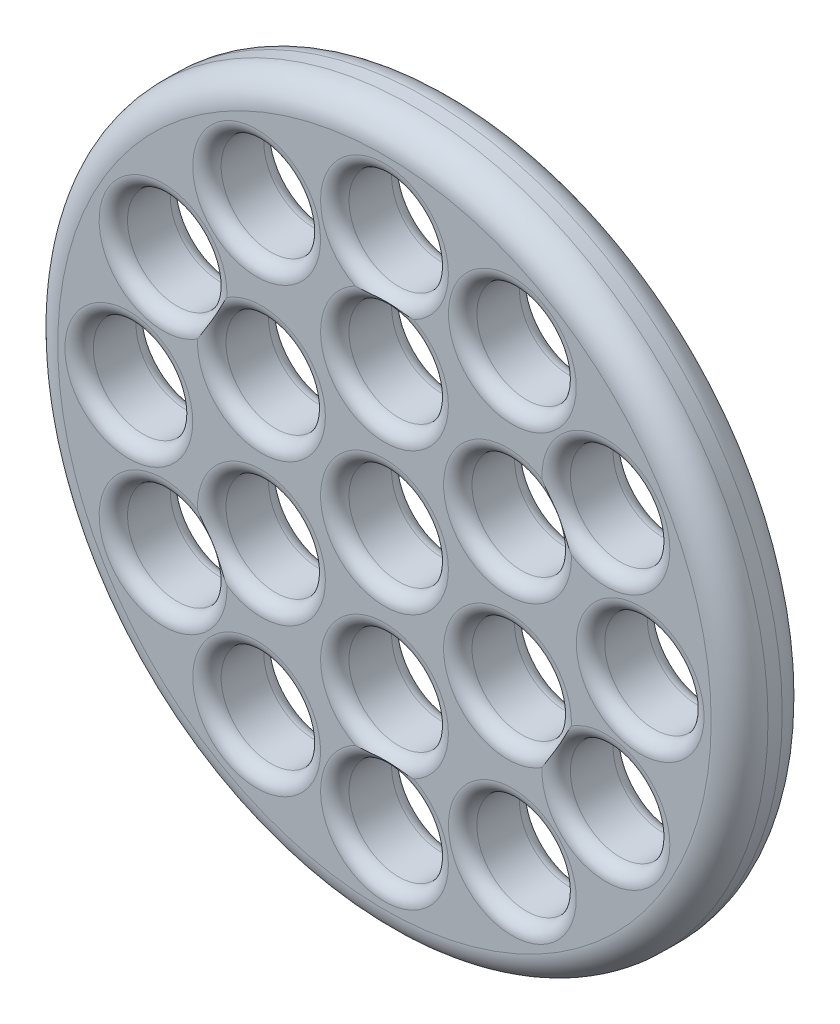
from build123d import *

# Parameters (mm, degrees)
SKETCH1_R           = 25
SKETCH1_R_2         = 22.5
SKETCH1_R_3         = 3.5
BOSS_EXTRUDE5_DEPTH = 5
FILLET10_R          = 2
FILLET11_R          = 1


with BuildPart() as part:
    # Sketch1 → Boss-Extrude5 (new body)
    # profile 1 of 2: a face of its own
    with BuildSketch(Plane.XY):
        Circle(SKETCH1_R)
        Circle(SKETCH1_R_2, mode=Mode.SUBTRACT)
    # profile 2 of 2: a face of its own
    with BuildSketch(Plane.XY):
        Circle(SKETCH1_R_2)
        with Locations((-15.588457268, -9)):
            Circle(SKETCH1_R_3, mode=Mode.SUBTRACT)
        with Locations((-9, -15.588457268)):
            Circle(SKETCH1_R_3, mode=Mode.SUBTRACT)
        with Locations((0, -18)):
            Circle(SKETCH1_R_3, mode=Mode.SUBTRACT)
        with Locations((9, -15.588457268)):
            Circle(SKETCH1_R_3, mode=Mode.SUBTRACT)
        with Locations((15.588457268, -9)):
            Circle(SKETCH1_R_3, mode=Mode.SUBTRACT)
        with Locations((18, 0)):
            Circle(SKETCH1_R_3, mode=Mode.SUBTRACT)
        with Locations((15.588457268, 9)):
            Circle(SKETCH1_R_3, mode=Mode.SUBTRACT)
        with Locations((9, 15.588457268)):
            Circle(SKETCH1_R_3, mode=Mode.SUBTRACT)
        with Locations((0, 18)):
            Circle(SKETCH1_R_3, mode=Mode.SUBTRACT)
        with Locations((-9, 15.588457268)):
            Circle(SKETCH1_R_3, mode=Mode.SUBTRACT)
        with Locations((-15.588457268, 9)):
            Circle(SKETCH1_R_3, mode=Mode.SUBTRACT)
        with Locations((-18, 0)):
            Circle(SKETCH1_R_3, mode=Mode.SUBTRACT)
        with Locations((-8.660254038, 5)):
            Circle(SKETCH1_R_3, mode=Mode.SUBTRACT)
        with Locations((-8.660254038, -5)):
            Circle(SKETCH1_R_3, mode=Mode.SUBTRACT)
        with Locations((0, -10)):
            Circle(SKETCH1_R_3, mode=Mode.SUBTRACT)
        with Locations((8.660254038, -5)):
            Circle(SKETCH1_R_3, mode=Mode.SUBTRACT)
        with Locations((8.660254038, 5)):
            Circle(SKETCH1_R_3, mode=Mode.SUBTRACT)
        Circle(SKETCH1_R_3, mode=Mode.SUBTRACT)
        with Locations((0, 10)):
            Circle(SKETCH1_R_3, mode=Mode.SUBTRACT)
    extrude(amount=BOSS_EXTRUDE5_DEPTH)

    # Fillet10
    fillet10_edges = [part.edges().sort_by_distance(p)[0] for p in [
        (-25, 0, 0),
        (-25, 0, 5),
    ]]
    fillet(fillet10_edges, radius=FILLET10_R)

    # Fillet11
    # the kernel refuses this fillet: 1 mm, written as the material it takes off along each edge
    with BuildSketch(Plane(origin=(-15.588457268, -9, 5), x_dir=(1, 0, 0), z_dir=(0, -1, 0))) as fillet11_piece_1:
        with BuildLine():
            CenterArc((3.5 + FILLET11_R, -FILLET11_R), FILLET11_R, 90, 90)
            Line((3.5, -FILLET11_R), (3.5, 0))
            Line((3.5, 0), (3.5 + FILLET11_R, 0))
        make_face()
    revolve(axis=Axis((-15.588457268, -9, 5), (0, 0, 1)), mode=Mode.SUBTRACT)
    with BuildSketch(Plane(origin=(0, 10, 0), x_dir=(1, 0, 0), z_dir=(0, -1, 0))) as fillet11_piece_2:
        with BuildLine():
            CenterArc((3.5 + FILLET11_R, FILLET11_R), FILLET11_R, 180, 90)
            Line((3.5, FILLET11_R), (3.5, 0))
            Line((3.5, 0), (3.5 + FILLET11_R, 0))
        make_face()
    revolve(axis=Axis((0, 10, 0), (0, 0, 1)), mode=Mode.SUBTRACT)
    with BuildSketch(Plane(origin=(0, 0, 0), x_dir=(1, 0, 0), z_dir=(0, -1, 0))) as fillet11_piece_3:
        with BuildLine():
            CenterArc((3.5 + FILLET11_R, FILLET11_R), FILLET11_R, 180, 90)
            Line((3.5, FILLET11_R), (3.5, 0))
            Line((3.5, 0), (3.5 + FILLET11_R, 0))
        make_face()
    revolve(axis=Axis((0, 0, 0), (0, 0, 1)), mode=Mode.SUBTRACT)
    with BuildSketch(Plane(origin=(8.660254038, 5, 0), x_dir=(1, 0, 0), z_dir=(0, -1, 0))) as fillet11_piece_4:
        with BuildLine():
            CenterArc((3.5 + FILLET11_R, FILLET11_R), FILLET11_R, 180, 90)
            Line((3.5, FILLET11_R), (3.5, 0))
            Line((3.5, 0), (3.5 + FILLET11_R, 0))
        make_face()
    revolve(axis=Axis((8.660254038, 5, 0), (0, 0, 1)), mode=Mode.SUBTRACT)
    with BuildSketch(Plane(origin=(8.660254038, -5, 0), x_dir=(1, 0, 0), z_dir=(0, -1, 0))) as fillet11_piece_5:
        with BuildLine():
            CenterArc((3.5 + FILLET11_R, FILLET11_R), FILLET11_R, 180, 90)
            Line((3.5, FILLET11_R), (3.5, 0))
            Line((3.5, 0), (3.5 + FILLET11_R, 0))
        make_face()
    revolve(axis=Axis((8.660254038, -5, 0), (0, 0, 1)), mode=Mode.SUBTRACT)
    with BuildSketch(Plane(origin=(0, -10, 0), x_dir=(1, 0, 0), z_dir=(0, -1, 0))) as fillet11_piece_6:
        with BuildLine():
            CenterArc((3.5 + FILLET11_R, FILLET11_R), FILLET11_R, 180, 90)
            Line((3.5, FILLET11_R), (3.5, 0))
            Line((3.5, 0), (3.5 + FILLET11_R, 0))
        make_face()
    revolve(axis=Axis((0, -10, 0), (0, 0, 1)), mode=Mode.SUBTRACT)
    with BuildSketch(Plane(origin=(-8.660254038, -5, 0), x_dir=(1, 0, 0), z_dir=(0, -1, 0))) as fillet11_piece_7:
        with BuildLine():
            CenterArc((3.5 + FILLET11_R, FILLET11_R), FILLET11_R, 180, 90)
            Line((3.5, FILLET11_R), (3.5, 0))
            Line((3.5, 0), (3.5 + FILLET11_R, 0))
        make_face()
    revolve(axis=Axis((-8.660254038, -5, 0), (0, 0, 1)), mode=Mode.SUBTRACT)
    with BuildSketch(Plane(origin=(-8.660254038, 5, 0), x_dir=(1, 0, 0), z_dir=(0, -1, 0))) as fillet11_piece_8:
        with BuildLine():
            CenterArc((3.5 + FILLET11_R, FILLET11_R), FILLET11_R, 180, 90)
            Line((3.5, FILLET11_R), (3.5, 0))
            Line((3.5, 0), (3.5 + FILLET11_R, 0))
        make_face()
    revolve(axis=Axis((-8.660254038, 5, 0), (0, 0, 1)), mode=Mode.SUBTRACT)
    with BuildSketch(Plane(origin=(-18, 0, 0), x_dir=(1, 0, 0), z_dir=(0, -1, 0))) as fillet11_piece_9:
        with BuildLine():
            CenterArc((3.5 + FILLET11_R, FILLET11_R), FILLET11_R, 180, 90)
            Line((3.5, FILLET11_R), (3.5, 0))
            Line((3.5, 0), (3.5 + FILLET11_R, 0))
        make_face()
    revolve(axis=Axis((-18, 0, 0), (0, 0, 1)), mode=Mode.SUBTRACT)
    with BuildSketch(Plane(origin=(-9, -15.588457268, 5), x_dir=(1, 0, 0), z_dir=(0, -1, 0))) as fillet11_piece_10:
        with BuildLine():
            CenterArc((3.5 + FILLET11_R, -FILLET11_R), FILLET11_R, 90, 90)
            Line((3.5, -FILLET11_R), (3.5, 0))
            Line((3.5, 0), (3.5 + FILLET11_R, 0))
        make_face()
    revolve(axis=Axis((-9, -15.588457268, 5), (0, 0, 1)), mode=Mode.SUBTRACT)
    with BuildSketch(Plane(origin=(-15.588457268, 9, 0), x_dir=(1, 0, 0), z_dir=(0, -1, 0))) as fillet11_piece_11:
        with BuildLine():
            CenterArc((3.5 + FILLET11_R, FILLET11_R), FILLET11_R, 180, 90)
            Line((3.5, FILLET11_R), (3.5, 0))
            Line((3.5, 0), (3.5 + FILLET11_R, 0))
        make_face()
    revolve(axis=Axis((-15.588457268, 9, 0), (0, 0, 1)), mode=Mode.SUBTRACT)
    with BuildSketch(Plane(origin=(-9, 15.588457268, 0), x_dir=(1, 0, 0), z_dir=(0, -1, 0))) as fillet11_piece_12:
        with BuildLine():
            CenterArc((3.5 + FILLET11_R, FILLET11_R), FILLET11_R, 180, 90)
            Line((3.5, FILLET11_R), (3.5, 0))
            Line((3.5, 0), (3.5 + FILLET11_R, 0))
        make_face()
    revolve(axis=Axis((-9, 15.588457268, 0), (0, 0, 1)), mode=Mode.SUBTRACT)
    with BuildSketch(Plane(origin=(0, 18, 0), x_dir=(1, 0, 0), z_dir=(0, -1, 0))) as fillet11_piece_13:
        with BuildLine():
            CenterArc((3.5 + FILLET11_R, FILLET11_R), FILLET11_R, 180, 90)
            Line((3.5, FILLET11_R), (3.5, 0))
            Line((3.5, 0), (3.5 + FILLET11_R, 0))
        make_face()
    revolve(axis=Axis((0, 18, 0), (0, 0, 1)), mode=Mode.SUBTRACT)
    with BuildSketch(Plane(origin=(9, 15.588457268, 0), x_dir=(1, 0, 0), z_dir=(0, -1, 0))) as fillet11_piece_14:
        with BuildLine():
            CenterArc((3.5 + FILLET11_R, FILLET11_R), FILLET11_R, 180, 90)
            Line((3.5, FILLET11_R), (3.5, 0))
            Line((3.5, 0), (3.5 + FILLET11_R, 0))
        make_face()
    revolve(axis=Axis((9, 15.588457268, 0), (0, 0, 1)), mode=Mode.SUBTRACT)
    with BuildSketch(Plane(origin=(15.588457268, 9, 0), x_dir=(1, 0, 0), z_dir=(0, -1, 0))) as fillet11_piece_15:
        with BuildLine():
            CenterArc((3.5 + FILLET11_R, FILLET11_R), FILLET11_R, 180, 90)
            Line((3.5, FILLET11_R), (3.5, 0))
            Line((3.5, 0), (3.5 + FILLET11_R, 0))
        make_face()
    revolve(axis=Axis((15.588457268, 9, 0), (0, 0, 1)), mode=Mode.SUBTRACT)
    with BuildSketch(Plane(origin=(18, 0, 0), x_dir=(1, 0, 0), z_dir=(0, -1, 0))) as fillet11_piece_16:
        with BuildLine():
            CenterArc((3.5 + FILLET11_R, FILLET11_R), FILLET11_R, 180, 90)
            Line((3.5, FILLET11_R), (3.5, 0))
            Line((3.5, 0), (3.5 + FILLET11_R, 0))
        make_face()
    revolve(axis=Axis((18, 0, 0), (0, 0, 1)), mode=Mode.SUBTRACT)
    with BuildSketch(Plane(origin=(15.588457268, -9, 0), x_dir=(1, 0, 0), z_dir=(0, -1, 0))) as fillet11_piece_17:
        with BuildLine():
            CenterArc((3.5 + FILLET11_R, FILLET11_R), FILLET11_R, 180, 90)
            Line((3.5, FILLET11_R), (3.5, 0))
            Line((3.5, 0), (3.5 + FILLET11_R, 0))
        make_face()
    revolve(axis=Axis((15.588457268, -9, 0), (0, 0, 1)), mode=Mode.SUBTRACT)
    with BuildSketch(Plane(origin=(9, -15.588457268, 0), x_dir=(1, 0, 0), z_dir=(0, -1, 0))) as fillet11_piece_18:
        with BuildLine():
            CenterArc((3.5 + FILLET11_R, FILLET11_R), FILLET11_R, 180, 90)
            Line((3.5, FILLET11_R), (3.5, 0))
            Line((3.5, 0), (3.5 + FILLET11_R, 0))
        make_face()
    revolve(axis=Axis((9, -15.588457268, 0), (0, 0, 1)), mode=Mode.SUBTRACT)
    with BuildSketch(Plane(origin=(0, -18, 5), x_dir=(1, 0, 0), z_dir=(0, -1, 0))) as fillet11_piece_19:
        with BuildLine():
            CenterArc((3.5 + FILLET11_R, -FILLET11_R), FILLET11_R, 90, 90)
            Line((3.5, -FILLET11_R), (3.5, 0))
            Line((3.5, 0), (3.5 + FILLET11_R, 0))
        make_face()
    revolve(axis=Axis((0, -18, 5), (0, 0, 1)), mode=Mode.SUBTRACT)
    with BuildSketch(Plane(origin=(0, -18, 0), x_dir=(1, 0, 0), z_dir=(0, -1, 0))) as fillet11_piece_20:
        with BuildLine():
            CenterArc((3.5 + FILLET11_R, FILLET11_R), FILLET11_R, 180, 90)
            Line((3.5, FILLET11_R), (3.5, 0))
            Line((3.5, 0), (3.5 + FILLET11_R, 0))
        make_face()
    revolve(axis=Axis((0, -18, 0), (0, 0, 1)), mode=Mode.SUBTRACT)
    with BuildSketch(Plane(origin=(-9, -15.588457268, 0), x_dir=(1, 0, 0), z_dir=(0, -1, 0))) as fillet11_piece_21:
        with BuildLine():
            CenterArc((3.5 + FILLET11_R, FILLET11_R), FILLET11_R, 180, 90)
            Line((3.5, FILLET11_R), (3.5, 0))
            Line((3.5, 0), (3.5 + FILLET11_R, 0))
        make_face()
    revolve(axis=Axis((-9, -15.588457268, 0), (0, 0, 1)), mode=Mode.SUBTRACT)
    with BuildSketch(Plane(origin=(-15.588457268, -9, 0), x_dir=(1, 0, 0), z_dir=(0, -1, 0))) as fillet11_piece_22:
        with BuildLine():
            CenterArc((3.5 + FILLET11_R, FILLET11_R), FILLET11_R, 180, 90)
            Line((3.5, FILLET11_R), (3.5, 0))
            Line((3.5, 0), (3.5 + FILLET11_R, 0))
        make_face()
    revolve(axis=Axis((-15.588457268, -9, 0), (0, 0, 1)), mode=Mode.SUBTRACT)
    with BuildSketch(Plane(origin=(9, -15.588457268, 5), x_dir=(1, 0, 0), z_dir=(0, -1, 0))) as fillet11_piece_23:
        with BuildLine():
            CenterArc((3.5 + FILLET11_R, -FILLET11_R), FILLET11_R, 90, 90)
            Line((3.5, -FILLET11_R), (3.5, 0))
            Line((3.5, 0), (3.5 + FILLET11_R, 0))
        make_face()
    revolve(axis=Axis((9, -15.588457268, 5), (0, 0, 1)), mode=Mode.SUBTRACT)
    with BuildSketch(Plane(origin=(15.588457268, -9, 5), x_dir=(1, 0, 0), z_dir=(0, -1, 0))) as fillet11_piece_24:
        with BuildLine():
            CenterArc((3.5 + FILLET11_R, -FILLET11_R), FILLET11_R, 90, 90)
            Line((3.5, -FILLET11_R), (3.5, 0))
            Line((3.5, 0), (3.5 + FILLET11_R, 0))
        make_face()
    revolve(axis=Axis((15.588457268, -9, 5), (0, 0, 1)), mode=Mode.SUBTRACT)
    with BuildSketch(Plane(origin=(18, 0, 5), x_dir=(1, 0, 0), z_dir=(0, -1, 0))) as fillet11_piece_25:
        with BuildLine():
            CenterArc((3.5 + FILLET11_R, -FILLET11_R), FILLET11_R, 90, 90)
            Line((3.5, -FILLET11_R), (3.5, 0))
            Line((3.5, 0), (3.5 + FILLET11_R, 0))
        make_face()
    revolve(axis=Axis((18, 0, 5), (0, 0, 1)), mode=Mode.SUBTRACT)
    with BuildSketch(Plane(origin=(15.588457268, 9, 5), x_dir=(1, 0, 0), z_dir=(0, -1, 0))) as fillet11_piece_26:
        with BuildLine():
            CenterArc((3.5 + FILLET11_R, -FILLET11_R), FILLET11_R, 90, 90)
            Line((3.5, -FILLET11_R), (3.5, 0))
            Line((3.5, 0), (3.5 + FILLET11_R, 0))
        make_face()
    revolve(axis=Axis((15.588457268, 9, 5), (0, 0, 1)), mode=Mode.SUBTRACT)
    with BuildSketch(Plane(origin=(9, 15.588457268, 5), x_dir=(1, 0, 0), z_dir=(0, -1, 0))) as fillet11_piece_27:
        with BuildLine():
            CenterArc((3.5 + FILLET11_R, -FILLET11_R), FILLET11_R, 90, 90)
            Line((3.5, -FILLET11_R), (3.5, 0))
            Line((3.5, 0), (3.5 + FILLET11_R, 0))
        make_face()
    revolve(axis=Axis((9, 15.588457268, 5), (0, 0, 1)), mode=Mode.SUBTRACT)
    with BuildSketch(Plane(origin=(0, 18, 5), x_dir=(1, 0, 0), z_dir=(0, -1, 0))) as fillet11_piece_28:
        with BuildLine():
            CenterArc((3.5 + FILLET11_R, -FILLET11_R), FILLET11_R, 90, 90)
            Line((3.5, -FILLET11_R), (3.5, 0))
            Line((3.5, 0), (3.5 + FILLET11_R, 0))
        make_face()
    revolve(axis=Axis((0, 18, 5), (0, 0, 1)), mode=Mode.SUBTRACT)
    with BuildSketch(Plane(origin=(-9, 15.588457268, 5), x_dir=(1, 0, 0), z_dir=(0, -1, 0))) as fillet11_piece_29:
        with BuildLine():
            CenterArc((3.5 + FILLET11_R, -FILLET11_R), FILLET11_R, 90, 90)
            Line((3.5, -FILLET11_R), (3.5, 0))
            Line((3.5, 0), (3.5 + FILLET11_R, 0))
        make_face()
    revolve(axis=Axis((-9, 15.588457268, 5), (0, 0, 1)), mode=Mode.SUBTRACT)
    with BuildSketch(Plane(origin=(-15.588457268, 9, 5), x_dir=(1, 0, 0), z_dir=(0, -1, 0))) as fillet11_piece_30:
        with BuildLine():
            CenterArc((3.5 + FILLET11_R, -FILLET11_R), FILLET11_R, 90, 90)
            Line((3.5, -FILLET11_R), (3.5, 0))
            Line((3.5, 0), (3.5 + FILLET11_R, 0))
        make_face()
    revolve(axis=Axis((-15.588457268, 9, 5), (0, 0, 1)), mode=Mode.SUBTRACT)
    with BuildSketch(Plane(origin=(-18, 0, 5), x_dir=(1, 0, 0), z_dir=(0, -1, 0))) as fillet11_piece_31:
        with BuildLine():
            CenterArc((3.5 + FILLET11_R, -FILLET11_R), FILLET11_R, 90, 90)
            Line((3.5, -FILLET11_R), (3.5, 0))
            Line((3.5, 0), (3.5 + FILLET11_R, 0))
        make_face()
    revolve(axis=Axis((-18, 0, 5), (0, 0, 1)), mode=Mode.SUBTRACT)
    with BuildSketch(Plane(origin=(-8.660254038, 5, 5), x_dir=(1, 0, 0), z_dir=(0, -1, 0))) as fillet11_piece_32:
        with BuildLine():
            CenterArc((3.5 + FILLET11_R, -FILLET11_R), FILLET11_R, 90, 90)
            Line((3.5, -FILLET11_R), (3.5, 0))
            Line((3.5, 0), (3.5 + FILLET11_R, 0))
        make_face()
    revolve(axis=Axis((-8.660254038, 5, 5), (0, 0, 1)), mode=Mode.SUBTRACT)
    with BuildSketch(Plane(origin=(-8.660254038, -5, 5), x_dir=(1, 0, 0), z_dir=(0, -1, 0))) as fillet11_piece_33:
        with BuildLine():
            CenterArc((3.5 + FILLET11_R, -FILLET11_R), FILLET11_R, 90, 90)
            Line((3.5, -FILLET11_R), (3.5, 0))
            Line((3.5, 0), (3.5 + FILLET11_R, 0))
        make_face()
    revolve(axis=Axis((-8.660254038, -5, 5), (0, 0, 1)), mode=Mode.SUBTRACT)
    with BuildSketch(Plane(origin=(0, -10, 5), x_dir=(1, 0, 0), z_dir=(0, -1, 0))) as fillet11_piece_34:
        with BuildLine():
            CenterArc((3.5 + FILLET11_R, -FILLET11_R), FILLET11_R, 90, 90)
            Line((3.5, -FILLET11_R), (3.5, 0))
            Line((3.5, 0), (3.5 + FILLET11_R, 0))
        make_face()
    revolve(axis=Axis((0, -10, 5), (0, 0, 1)), mode=Mode.SUBTRACT)
    with BuildSketch(Plane(origin=(8.660254038, -5, 5), x_dir=(1, 0, 0), z_dir=(0, -1, 0))) as fillet11_piece_35:
        with BuildLine():
            CenterArc((3.5 + FILLET11_R, -FILLET11_R), FILLET11_R, 90, 90)
            Line((3.5, -FILLET11_R), (3.5, 0))
            Line((3.5, 0), (3.5 + FILLET11_R, 0))
        make_face()
    revolve(axis=Axis((8.660254038, -5, 5), (0, 0, 1)), mode=Mode.SUBTRACT)
    with BuildSketch(Plane(origin=(8.660254038, 5, 5), x_dir=(1, 0, 0), z_dir=(0, -1, 0))) as fillet11_piece_36:
        with BuildLine():
            CenterArc((3.5 + FILLET11_R, -FILLET11_R), FILLET11_R, 90, 90)
            Line((3.5, -FILLET11_R), (3.5, 0))
            Line((3.5, 0), (3.5 + FILLET11_R, 0))
        make_face()
    revolve(axis=Axis((8.660254038, 5, 5), (0, 0, 1)), mode=Mode.SUBTRACT)
    with BuildSketch(Plane(origin=(0, 0, 5), x_dir=(1, 0, 0), z_dir=(0, -1, 0))) as fillet11_piece_37:
        with BuildLine():
            CenterArc((3.5 + FILLET11_R, -FILLET11_R), FILLET11_R, 90, 90)
            Line((3.5, -FILLET11_R), (3.5, 0))
            Line((3.5, 0), (3.5 + FILLET11_R, 0))
        make_face()
    revolve(axis=Axis((0, 0, 5), (0, 0, 1)), mode=Mode.SUBTRACT)
    with BuildSketch(Plane(origin=(0, 10, 5), x_dir=(1, 0, 0), z_dir=(0, -1, 0))) as fillet11_piece_38:
        with BuildLine():
            CenterArc((3.5 + FILLET11_R, -FILLET11_R), FILLET11_R, 90, 90)
            Line((3.5, -FILLET11_R), (3.5, 0))
            Line((3.5, 0), (3.5 + FILLET11_R, 0))
        make_face()
    revolve(axis=Axis((0, 10, 5), (0, 0, 1)), mode=Mode.SUBTRACT)


solid = part.part
